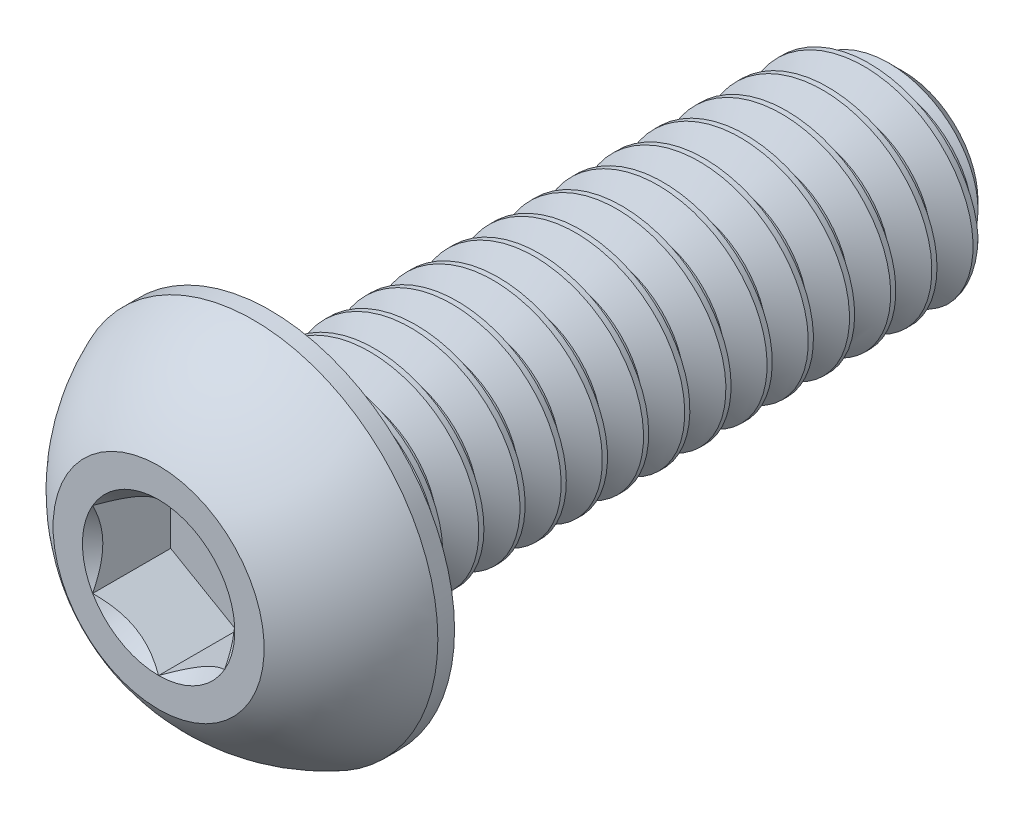
from build123d import *

# Parameters (mm, degrees)
SKETCH1_W          = 19.05
SKETCH1_H          = 3.175
CHAMFER1_SIZE      = 0.929268293
CUT_SWEEP1_PITCH   = 1.23902439
CUT_EXTRUDE2_DEPTH = 2.34696


with BuildPart() as part:
    # Sketch1 → Revolve1 (revolve)
    with BuildSketch(Plane(origin=(0, 0, 0), x_dir=(0, 0, -1), z_dir=(1, 0, 0))):
        with Locations((12.8778, 1.5875)):
            Rectangle(SKETCH1_W, SKETCH1_H)
    revolve(axis=Axis((0, 0, -22.4028), (0, 0, 1)))

    # Chamfer1
    chamfer1_edges = [part.edges().sort_by_distance(p)[0] for p in [
        (0, -3.175, -22.4028),
    ]]
    chamfer(chamfer1_edges, length=CHAMFER1_SIZE)

    # Cut-Sweep1: the profile of Sketch2 profile screwed along a right-hand helix of 18.081 turns, 8 arcs to a turn; built about Z, then put on its axis
    cut_sweep1_z = Axis((0, 0, 0), (0, 0, 1))
    cut_sweep1_corners = [(3.1753, 0, 0.000173205), (3.1753, 0, -1.084319547), (2.370230052, 0, -0.619512195), (2.370230052, 0, -0.464634146)]
    with BuildLine(mode=Mode.PRIVATE) as cut_sweep1_profile:
        Line(cut_sweep1_corners[0], cut_sweep1_corners[1])
        Line(cut_sweep1_corners[1], cut_sweep1_corners[2])
        Line(cut_sweep1_corners[2], cut_sweep1_corners[3])
        Line(cut_sweep1_corners[3], cut_sweep1_corners[0])
    cut_sweep1_cap = Face(cut_sweep1_profile.wire())
    cut_sweep1_turn_angles = [0, 22.5, 45, 67.5, 90, 112.5, 135, 157.5, 180, 202.5, 225, 247.5, 270, 292.5, 315, 337.5, 360]
    cut_sweep1_turn_weights = [1, 0.9238795325112867, 1, 0.9238795325112867, 1, 0.9238795325112867, 1, 0.9238795325112867, 1, 0.9238795325112867, 1, 0.9238795325112867, 1, 0.9238795325112867, 1, 0.9238795325112867, 1]
    cut_sweep1_turn_rails = [Edge.make_bspline([Vector(p[0], p[1], 0).rotate(cut_sweep1_z, cut_sweep1_turn_angles[k]) / cut_sweep1_turn_weights[k] + Vector(0, 0, p[2] + CUT_SWEEP1_PITCH * cut_sweep1_turn_angles[k] / 360) for k in range(17)], [0, 0, 0, 1, 1, 2, 2, 3, 3, 4, 4, 5, 5, 6, 6, 7, 7, 8, 8, 8], 2, cut_sweep1_turn_weights) for p in cut_sweep1_corners]
    cut_sweep1_turn_sides = [Face.make_surface_from_curves(cut_sweep1_turn_rails[p[0]], cut_sweep1_turn_rails[p[1]]) for p in [(0, 1), (1, 2), (2, 3), (3, 0)]]
    cut_sweep1_last_angles = [6480, 6494.58, 6509.16]
    cut_sweep1_last_weights = [1, 0.9677971003289058, 1]
    cut_sweep1_last_rails = [Edge.make_bspline([Vector(p[0], p[1], 0).rotate(cut_sweep1_z, cut_sweep1_last_angles[k]) / cut_sweep1_last_weights[k] + Vector(0, 0, p[2] + CUT_SWEEP1_PITCH * cut_sweep1_last_angles[k] / 360) for k in range(3)], [0, 0, 0, 1, 1, 1], 2, cut_sweep1_last_weights) for p in cut_sweep1_corners]
    cut_sweep1_last_sides = [Face.make_surface_from_curves(cut_sweep1_last_rails[p[0]], cut_sweep1_last_rails[p[1]]) for p in [(0, 1), (1, 2), (2, 3), (3, 0)]]
    cut_sweep1 = Plane(origin=(0, 0, -22.4028), x_dir=(0, 1, 0), z_dir=(0, 0, 1)) * Solid(Shell([*[p.moved(Location((0, 0, CUT_SWEEP1_PITCH * i))) for i in range(18) for p in cut_sweep1_turn_sides], *cut_sweep1_last_sides, cut_sweep1_cap, cut_sweep1_cap.rotate(cut_sweep1_z, 6509.16).moved(Location((0, 0, CUT_SWEEP1_PITCH * 6509.16 / 360)))]))
    add(cut_sweep1, mode=Mode.SUBTRACT)

    # Sketch7 → Revolve2 (revolve)
    with BuildSketch(Plane(origin=(0, 0, 0), x_dir=(0, 0, -1), z_dir=(1, 0, 0)), mode=Mode.PRIVATE) as revolve2_sk:
        with BuildLine():
            Line((2.84988, 5.5499), (3.3528, 5.5499))
            Line((3.3528, 5.5499), (3.3528, 0))
            Line((3.3528, 0), (0, 0))
            Line((0, 0), (0, 3.175))
            ThreePointArc((0, 3.175), (1.235921075, 4.58927271), (2.84988, 5.5499))
        make_face()
    revolve(revolve2_sk.sketch.rotate(Axis((0, 0, 0), (0, 0, -1)), 189.052465709), axis=Axis((0, 0, 0), (0, 0, -1)))

    # Sketch5 → Cut-Extrude2 (cut)
    with BuildSketch(Plane.XY):
        Polygon((1.984375, -1.14567944), (1.984375, 1.14567944), (0, 2.291358881), (-1.984375, 1.14567944), (-1.984375, -1.14567944), (0, -2.291358881), align=None)
    extrude(amount=-CUT_EXTRUDE2_DEPTH, mode=Mode.SUBTRACT)

    # Cut-Extrude3 cone 1 section (through the dimple's axis) → Cut-Extrude3 (revolve, cut)
    with BuildSketch(Plane(origin=(0, 0, 0), x_dir=(0, -1, 0), z_dir=(1, 0, 0))):
        Polygon((0, 0), (2.291358881, 0), (0, 2.291358881), align=None)
    revolve(axis=Axis((0, 0, 0), (0, 0, -1)), mode=Mode.SUBTRACT)


solid = part.part
